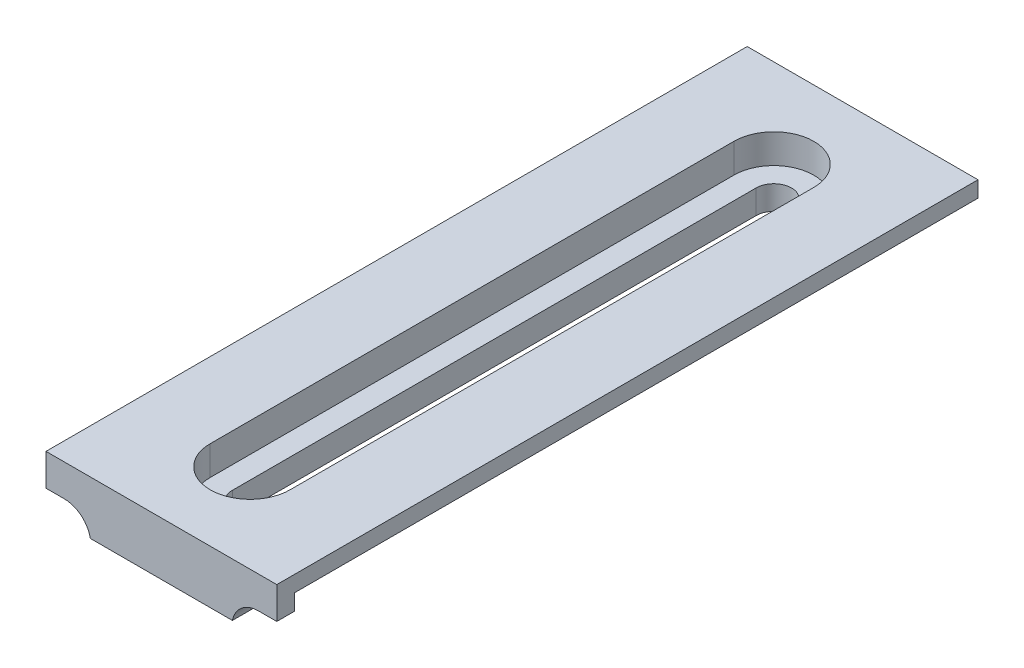
from build123d import *

# Parameters (mm, degrees)
DODANIE_WYCI_GNI_CIE1_DEPTH = 79
WYTNIJ_WYCI_GNI_CIE1_DEPTH  = 81.286985247
WYTNIJ_WYCI_GNI_CIE2_DEPTH  = 3.3
SZKIC5_W                    = 26
SZKIC5_H                    = 3.6
SDF_DEPTH                   = 2
ZAOKR_GLENIE3_R             = 3


with BuildPart() as part:
    # Szkic1 → Dodanie-wyciągnięcie1 (new body)
    with BuildSketch(Plane.XY):
        Polygon((-13, 0), (-13, 1.8), (13, 1.8), (13, 0), (8, 0), (8, -4.2), (-8, -4.2), (-8, 0), align=None)
    extrude(amount=DODANIE_WYCI_GNI_CIE1_DEPTH)

    # Szkic3 → Wytnij-wyciągnięcie1 (cut, through all)
    with BuildSketch(Plane.XZ.offset(4.2)):
        with BuildLine():
            Line((2, 69), (2, 10))
            ThreePointArc((2, 10), (0, 8), (-2, 10))
            Line((-2, 10), (-2, 69))
            ThreePointArc((-2, 69), (0, 71), (2, 69))
        make_face()
    extrude(amount=-WYTNIJ_WYCI_GNI_CIE1_DEPTH, mode=Mode.SUBTRACT)

    # Szkic4 → Wytnij-wyciągnięcie2 (cut)
    with BuildSketch(Plane(origin=(0, 1.8, 0), x_dir=(1, 0, 0), z_dir=(0, 1, 0))):
        with BuildLine():
            Line((-4.5, -69), (-4.5, -10))
            ThreePointArc((-4.5, -10), (0, -5.5), (4.5, -10))
            Line((4.5, -10), (4.5, -69))
            ThreePointArc((4.5, -69), (0, -73.5), (-4.5, -69))
        make_face()
    extrude(amount=-WYTNIJ_WYCI_GNI_CIE2_DEPTH, mode=Mode.SUBTRACT)

    # Szkic5 → sdf (add)
    with BuildSketch(Plane.XY.offset(79)):
        Rectangle(SZKIC5_W, SZKIC5_H)
    extrude(amount=-SDF_DEPTH)

    # Zaokrąglenie3
    # the kernel refuses this fillet: 3 mm, written as the material it adds along each edge
    with BuildSketch(Plane(origin=(8, -1.8, 77), x_dir=(1.5609735726224723e-12, -1.0, 0), z_dir=(0, 0, 1)), Plane(origin=(-8, -1.8, 79), x_dir=(-1.5698553568194677e-12, -1.0, 0), z_dir=(0, 0, -1))) as zaokr_glenie3_piece_1:
        with BuildLine():
            CenterArc((3, 2.939387691), ZAOKR_GLENIE3_R, 180, 78.463040967)
            Line((0, 2.939387691), (-0.06, 2.939387691))
            Line((-0.06, 2.939387691), (-0.06, 0))
            Line((-0.06, 0), (0, -0.06))
            ThreePointArc((0, -0.06), (1.2, -0.06), (2.388, -0.058787754))
            Line((2.388, -0.058787754), (2.4, 0))
        make_face()
    extrude(amount=2)


solid = part.part
